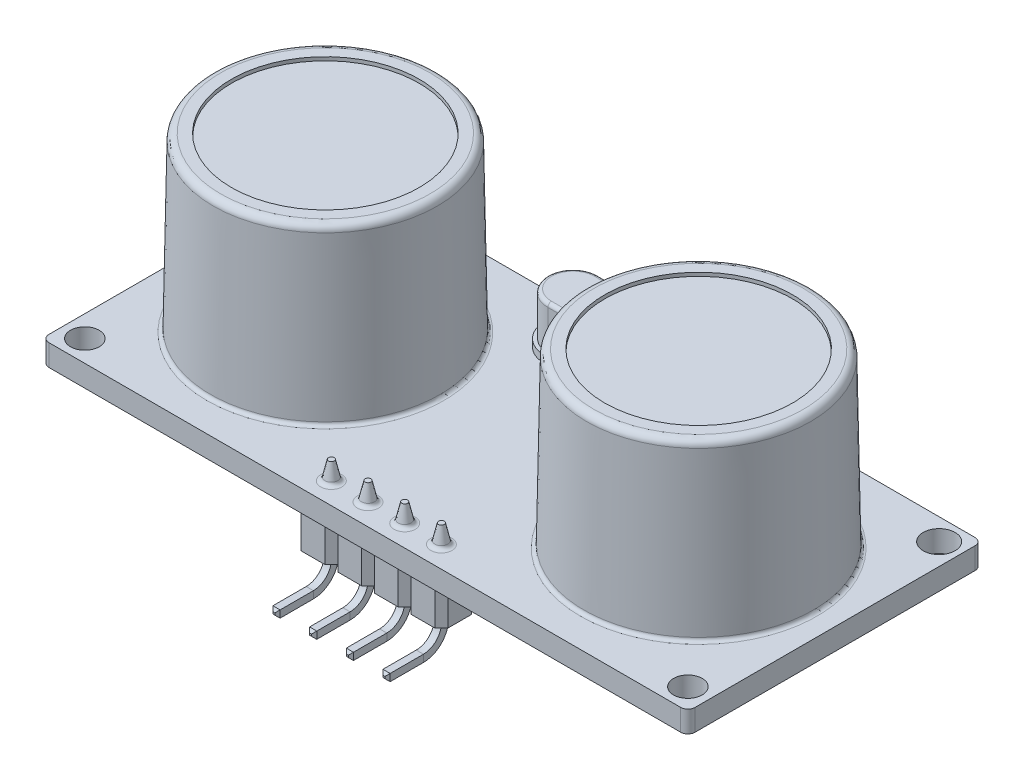
from build123d import *

# Parameters (mm, degrees)
SKETCH1_W                     = 45
SKETCH1_H                     = 20.5
BOSS_EXTRUDE1_DEPTH           = 1.5
SKETCH2_R                     = 1
SKETCH2_R_2                   = 1.109454148
CUT_EXTRUDE1_DEPTH            = 1.5
SKETCH3_R                     = 8
BOSS_EXTRUDE2_DEPTH           = 12
BOSS_EXTRUDE2_DRAFT           = 1
BOSS_EXTRUDE2_PROFILE_2_DEPTH = 12
BOSS_EXTRUDE2_PROFILE_2_DRAFT = 1
BOSS_EXTRUDE3_DEPTH           = 0.5
BOSS_EXTRUDE4_DEPTH           = 3
FILLET1_R                     = 0.25
SKETCH6_R                     = 6.540539221
CUT_EXTRUDE2_DEPTH            = 0.25
FILLET2_R                     = 0.25
FILLET3_R                     = 0.3
LPATTERN1_COUNT               = 4
LPATTERN1_PITCH               = 2.555
FILLET3_OF_LPATTERN1_R        = 0.3
BOSS_EXTRUDE5_DEPTH           = 2.5
LPATTERN2_COUNT               = 4
LPATTERN2_PITCH               = 2.555
SKETCH10_W                    = 0.5
SKETCH10_H                    = 0.5
CHAMFER1_SIZE                 = 0.18
LPATTERN3_COUNT               = 4
LPATTERN3_PITCH               = 2.555
CHAMFER1_OF_LPATTERN3_SIZE    = 0.18
SKETCH12_W                    = 10
SKETCH12_H                    = 4
BOSS_EXTRUDE6_DEPTH           = 0.5
BOSS_EXTRUDE7_START           = -0.5
SKETCH13_W                    = 0.2
SKETCH13_H                    = 6
BOSS_EXTRUDE7_DEPTH           = 0.15
LPATTERN4_COUNT               = 7
LPATTERN4_PITCH               = 1.3
MIRROR1_START                 = -0.5
MIRROR1_COPY_1_SKETCH_W       = 0.2
MIRROR1_COPY_1_SKETCH_H       = 6
MIRROR1_COPY_1_DEPTH          = 0.15
MIRROR1_COPY_2_SKETCH_W       = 0.2
MIRROR1_COPY_2_SKETCH_H       = 6
MIRROR1_COPY_2_DEPTH          = 0.15
MIRROR1_COPY_3_SKETCH_W       = 0.2
MIRROR1_COPY_3_SKETCH_H       = 6
MIRROR1_COPY_3_DEPTH          = 0.15
MIRROR1_COPY_4_SKETCH_W       = 0.2
MIRROR1_COPY_4_SKETCH_H       = 6
MIRROR1_COPY_4_DEPTH          = 0.15
MIRROR1_COPY_5_SKETCH_W       = 0.2
MIRROR1_COPY_5_SKETCH_H       = 6
MIRROR1_COPY_5_DEPTH          = 0.15
MIRROR1_COPY_6_SKETCH_W       = 0.2
MIRROR1_COPY_6_SKETCH_H       = 6
MIRROR1_COPY_6_DEPTH          = 0.15
SKETCH15_W                    = 1
SKETCH15_H                    = 0.35
BOSS_EXTRUDE8_DEPTH           = 0.3
SKETCH_PATTERN1_START         = -7.777519555
SKETCH_PATTERN1_OUTLINE_W     = 1
SKETCH_PATTERN1_OUTLINE_H     = 0.3
SKETCH_PATTERN1_OUTLINE_W_2   = 1.97077238
SKETCH_PATTERN1_DEPTH         = 0.35
SKETCH_PATTERN1_START_2       = 5.998202781
SKETCH_PATTERN1_2_OUTLINE_W   = 1
SKETCH_PATTERN1_2_OUTLINE_H   = 0.3
SKETCH_PATTERN1_2_DEPTH       = 0.35
SKETCH_PATTERN1_START_3       = 7.246338698
SKETCH_PATTERN1_3_OUTLINE_W   = 1
SKETCH_PATTERN1_3_OUTLINE_H   = 0.3
SKETCH_PATTERN1_3_DEPTH       = 0.35
SKETCH_PATTERN1_START_4       = -5.281247723
SKETCH_PATTERN1_4_OUTLINE_W   = 1
SKETCH_PATTERN1_4_OUTLINE_H   = 0.3
SKETCH_PATTERN1_4_DEPTH       = 0.35
SKETCH_PATTERN1_START_5       = -4.634066136
SKETCH_PATTERN1_5_OUTLINE_W   = 1
SKETCH_PATTERN1_5_OUTLINE_H   = 0.3
SKETCH_PATTERN1_5_DEPTH       = 0.35
SKETCH_PATTERN1_START_6       = -6.436929127
SKETCH_PATTERN1_6_OUTLINE_W   = 1
SKETCH_PATTERN1_6_OUTLINE_H   = 0.3
SKETCH_PATTERN1_6_DEPTH       = 0.35
SKETCH_PATTERN1_START_7       = 2.484931313
SKETCH_PATTERN1_7_OUTLINE_W   = 1
SKETCH_PATTERN1_7_OUTLINE_H   = 0.3
SKETCH_PATTERN1_7_DEPTH       = 0.35
SKETCH_PATTERN1_START_8       = 3.36324918
SKETCH_PATTERN1_8_OUTLINE_W   = 1
SKETCH_PATTERN1_8_OUTLINE_H   = 0.3
SKETCH_PATTERN1_8_DEPTH       = 0.35
SKETCH_PATTERN1_START_9       = 5.397248451
SKETCH_PATTERN1_9_OUTLINE_W   = 1
SKETCH_PATTERN1_9_OUTLINE_H   = 0.3
SKETCH_PATTERN1_9_DEPTH       = 0.35
FILLET4_R                     = 0.5
FILLET5_R                     = 0.5


# Read off the part's stored shape, not the designer's step: Sketch-Pattern1
with BuildPart() as part:
    # Sketch1 → Boss-Extrude1 (new body)
    with BuildSketch(Plane(origin=(0, 0, 0), x_dir=(1, 0, 0), z_dir=(0, 1, 0))):
        Rectangle(SKETCH1_W, SKETCH1_H)
    extrude(amount=BOSS_EXTRUDE1_DEPTH)

    # Sketch2 → Cut-Extrude1 (cut)
    with BuildSketch(Plane(origin=(0, 1.5, 0), x_dir=(1, 0, 0), z_dir=(0, 1, 0))):
        with Locations(Location((-21, 8.75, 0), (0, 0, 270))):
            Circle(SKETCH2_R)
        with Locations(Location((21, 8.75, 0), (0, 0, 270))):
            Circle(SKETCH2_R_2)
        with Locations(Location((21, -8.75, 0), (0, 0, 270))):
            Circle(SKETCH2_R)
        with Locations(Location((-21, -8.75, 0), (0, 0, 270))):
            Circle(SKETCH2_R)
    extrude(amount=-CUT_EXTRUDE1_DEPTH, mode=Mode.SUBTRACT)


with BuildPart() as boss_extrude2_tool:
    # Sketch3 → Boss-Extrude2 (with draft: the straight prism first)
    with BuildSketch(Plane(origin=(0, 1.5, 0), x_dir=(1, 0, 0), z_dir=(0, 1, 0))):
        with Locations((-13, 0)):
            Circle(SKETCH3_R)
    extrude(amount=BOSS_EXTRUDE2_DEPTH)
    # Boss-Extrude2: the draft: its side faces are tilted about the plane it starts from
    boss_extrude2_sides = [boss_extrude2_tool.faces().sort_by_distance(p)[0] for p in [
        (-21, 7.5, 0),
    ]]
    draft(boss_extrude2_sides, Plane(origin=(0, 1.5, 0), x_dir=(1, 0, 0), z_dir=(0, 1, 0)), BOSS_EXTRUDE2_DRAFT)


with BuildPart() as part_1:
    add(part.part)

    # Boss-Extrude2: add boss_extrude2_tool
    add(boss_extrude2_tool.part)


with BuildPart() as boss_extrude2_profile_2_tool:
    # Sketch3 → Boss-Extrude2 profile 2 (with draft: the straight prism first)
    with BuildSketch(Plane(origin=(0, 1.5, 0), x_dir=(1, 0, 0), z_dir=(0, 1, 0))):
        with Locations((13, 0)):
            Circle(SKETCH3_R)
    extrude(amount=BOSS_EXTRUDE2_PROFILE_2_DEPTH)
    # Boss-Extrude2 profile 2: the draft: its side faces are tilted about the plane it starts from
    boss_extrude2_profile_2_sides = [boss_extrude2_profile_2_tool.faces().sort_by_distance(p)[0] for p in [
        (5, 7.5, 0),
    ]]
    draft(boss_extrude2_profile_2_sides, Plane(origin=(0, 1.5, 0), x_dir=(1, 0, 0), z_dir=(0, 1, 0)), BOSS_EXTRUDE2_PROFILE_2_DRAFT)


with BuildPart() as part_2:
    add(part_1.part)

    # Boss-Extrude2 profile 2: add boss_extrude2_profile_2_tool
    add(boss_extrude2_profile_2_tool.part)

    # Sketch4 → Boss-Extrude3 (add)
    with BuildSketch(Plane(origin=(0, 1.5, 0), x_dir=(1, 0, 0), z_dir=(0, 1, 0))):
        with BuildLine():
            ThreePointArc((-5.5, 7.75), (-4.914213562, 6.335786438), (-3.5, 5.75))
            Line((-3.5, 5.75), (3.5, 5.75))
            ThreePointArc((3.5, 5.75), (4.914213562, 6.335786438), (5.5, 7.75))
            ThreePointArc((5.5, 7.75), (4.914213562, 9.164213562), (3.5, 9.75))
            Line((3.5, 9.75), (-3.5, 9.75))
            ThreePointArc((-3.5, 9.75), (-4.914213562, 9.164213562), (-5.5, 7.75))
        make_face()
    extrude(amount=BOSS_EXTRUDE3_DEPTH)

    # Sketch5 → Boss-Extrude4 (add)
    with BuildSketch(Plane(origin=(0, 2, 0), x_dir=(1, 0, 0), z_dir=(0, 1, 0))):
        with BuildLine():
            Line((3.5, 9.5), (-3.5, 9.5))
            ThreePointArc((-3.5, 9.5), (-5.25, 7.75), (-3.5, 6))
            Line((-3.5, 6), (3.5, 6))
            ThreePointArc((3.5, 6), (5.25, 7.75), (3.5, 9.5))
        make_face()
    extrude(amount=BOSS_EXTRUDE4_DEPTH)

    # Fillet1
    fillet1_edges = [part_2.edges().sort_by_distance(p)[0] for p in [
        (5.25, 5, -7.75),
        (0, 5, -9.5),
        (-5.25, 5, -7.75),
        (0, 5, -6),
    ]]
    fillet(fillet1_edges, radius=FILLET1_R)

    # Sketch6 → Cut-Extrude2 (cut)
    with BuildSketch(Plane(origin=(0, 13.5, 0), x_dir=(1, 0, 0), z_dir=(0, 1, 0))):
        with Locations(Location((-13, 0, 0), (0, 0, 270))):
            Circle(SKETCH6_R)
        with Locations(Location((13, 0, 0), (0, 0, 270))):
            Circle(SKETCH6_R)
    extrude(amount=-CUT_EXTRUDE2_DEPTH, mode=Mode.SUBTRACT)

    # Fillet2
    fillet2_edges = [part_2.edges().sort_by_distance(p)[0] for p in [
        (-21, 1.5, 0),
        (5, 1.5, 0),
    ]]
    fillet(fillet2_edges, radius=FILLET2_R)

    # Sketch8 → Revolve1 (revolve)
    with BuildSketch(Plane.XY.offset(8.75), mode=Mode.PRIVATE) as revolve1_sk:
        Polygon((3.8325, 1.5), (3.8325, 2.8), (4.0325, 2.8), (4.3325, 1.5), align=None)
    revolve1 = revolve(revolve1_sk.sketch.rotate(Axis((3.8325, 1.5, 8.75), (0, 1, 0)), 90), axis=Axis((3.8325, 1.5, 8.75), (0, 1, 0)))

    # Fillet3
    fillet3_edges = [part_2.edges().sort_by_distance(p)[0] for p in [
        (3.8325, 1.5, 9.25),
    ]]
    fillet(fillet3_edges, radius=FILLET3_R)

    # LPattern1: Revolve1 ×4
    with Locations(*[(-i * LPATTERN1_PITCH, 0, 0) for i in range(1, LPATTERN1_COUNT)]):
        add(revolve1)

    # Fillet3 of LPattern1
    fillet3_of_lpattern1_edges = [part_2.edges().sort_by_distance(p)[0] for p in [
        (1.2775, 1.5, 9.25),
        (-1.2775, 1.5, 9.25),
        (-3.8325, 1.5, 9.25),
    ]]
    fillet(fillet3_of_lpattern1_edges, radius=FILLET3_OF_LPATTERN1_R)

    # Sketch9 → Boss-Extrude5 (add)
    with BuildSketch(Plane.XZ):
        Polygon((3.005, 7.4725), (4.66, 7.4725), (5.11, 7.9225), (5.11, 9.5775), (4.66, 10.0275), (3.005, 10.0275), (2.555, 9.5775), (2.555, 7.9225), align=None)
    boss_extrude5 = extrude(amount=BOSS_EXTRUDE5_DEPTH)

    # LPattern2: Boss-Extrude5 ×4
    with Locations(*[(-i * LPATTERN2_PITCH, 0, 0) for i in range(1, LPATTERN2_COUNT)]):
        add(boss_extrude5)

    # Sweep1: sweep along a path in Sketch11
    with BuildLine(Plane(origin=(3.8325, 0, 0), x_dir=(0, 0, -1), z_dir=(1, 0, 0))) as sweep1_path:
        Line((-8.75, -2.5), (-8.75, -3))
        ThreePointArc((-8.75, -3), (-9.189339828, -4.060660172), (-10.25, -4.5))
        Line((-10.25, -4.5), (-12.75, -4.5))
    # Sketch10 → Sweep1 (sweep)
    with BuildSketch(Plane.XZ.offset(2.5)):
        with Locations((3.8325, 8.75)):
            Rectangle(SKETCH10_W, SKETCH10_H)
    sweep1 = sweep(path=sweep1_path.line)

    # Chamfer1
    chamfer1_edges = [part_2.edges().sort_by_distance(p)[0] for p in [
        (4.0825, -4.5, 12.75),
        (3.8325, -4.25, 12.75),
        (3.5825, -4.5, 12.75),
        (3.8325, -4.75, 12.75),
    ]]
    chamfer(chamfer1_edges, length=CHAMFER1_SIZE)

    # LPattern3: Sweep1 ×4
    with Locations(*[(-i * LPATTERN3_PITCH, 0, 0) for i in range(1, LPATTERN3_COUNT)]):
        add(sweep1)

    # Chamfer1 of LPattern3
    chamfer1_of_lpattern3_edges = [part_2.edges().sort_by_distance(p)[0] for p in [
        (1.5275, -4.5, 12.75),
        (1.2775, -4.25, 12.75),
        (1.0275, -4.5, 12.75),
        (1.2775, -4.75, 12.75),
        (-1.0275, -4.5, 12.75),
        (-1.2775, -4.25, 12.75),
        (-1.5275, -4.5, 12.75),
        (-1.2775, -4.75, 12.75),
        (-3.5825, -4.5, 12.75),
        (-3.8325, -4.25, 12.75),
        (-4.0825, -4.5, 12.75),
        (-3.8325, -4.75, 12.75),
    ]]
    chamfer(chamfer1_of_lpattern3_edges, length=CHAMFER1_OF_LPATTERN3_SIZE)

    # Sketch12 → Boss-Extrude6 (add)
    with BuildSketch(Plane.XZ):
        with Locations((12.5, 0)):
            Rectangle(SKETCH12_W, SKETCH12_H)
    boss_extrude6 = extrude(amount=BOSS_EXTRUDE6_DEPTH)

    # Sketch13 → Boss-Extrude7 (add)
    with BuildSketch(Plane.XZ.offset(0.5).offset(BOSS_EXTRUDE7_START)):
        with Locations((16.5, 0)):
            Rectangle(SKETCH13_W, SKETCH13_H)
    boss_extrude7 = extrude(amount=BOSS_EXTRUDE7_DEPTH)

    # LPattern4: Boss-Extrude7 ×7
    with Locations(*[(-i * LPATTERN4_PITCH, 0, 0) for i in range(1, LPATTERN4_COUNT)]):
        add(boss_extrude7)

    # Mirror1: Boss-Extrude6, Boss-Extrude7 across plane
    add(boss_extrude6.mirror(Plane(origin=(0, 0, 0), x_dir=(0, 0, 1), z_dir=(1, 0, 0))))
    add(boss_extrude7.mirror(Plane(origin=(0, 0, 0), x_dir=(0, 0, 1), z_dir=(1, 0, 0))))

    # Mirror1 copy 1 sketch → Mirror1 copy 1 (add)
    with BuildSketch(Plane(origin=(1.3, -0.5, 0), x_dir=(-1, 0, 0), z_dir=(0, -1, 0)).offset(MIRROR1_START)):
        with Locations((16.5, 0)):
            Rectangle(MIRROR1_COPY_1_SKETCH_W, MIRROR1_COPY_1_SKETCH_H)
    extrude(amount=MIRROR1_COPY_1_DEPTH)

    # Mirror1 copy 2 sketch → Mirror1 copy 2 (add)
    with BuildSketch(Plane(origin=(2.6, -0.5, 0), x_dir=(-1, 0, 0), z_dir=(0, -1, 0)).offset(MIRROR1_START)):
        with Locations((16.5, 0)):
            Rectangle(MIRROR1_COPY_2_SKETCH_W, MIRROR1_COPY_2_SKETCH_H)
    extrude(amount=MIRROR1_COPY_2_DEPTH)

    # Mirror1 copy 3 sketch → Mirror1 copy 3 (add)
    with BuildSketch(Plane(origin=(3.9, -0.5, 0), x_dir=(-1, 0, 0), z_dir=(0, -1, 0)).offset(MIRROR1_START)):
        with Locations((16.5, 0)):
            Rectangle(MIRROR1_COPY_3_SKETCH_W, MIRROR1_COPY_3_SKETCH_H)
    extrude(amount=MIRROR1_COPY_3_DEPTH)

    # Mirror1 copy 4 sketch → Mirror1 copy 4 (add)
    with BuildSketch(Plane(origin=(5.2, -0.5, 0), x_dir=(-1, 0, 0), z_dir=(0, -1, 0)).offset(MIRROR1_START)):
        with Locations((16.5, 0)):
            Rectangle(MIRROR1_COPY_4_SKETCH_W, MIRROR1_COPY_4_SKETCH_H)
    extrude(amount=MIRROR1_COPY_4_DEPTH)

    # Mirror1 copy 5 sketch → Mirror1 copy 5 (add)
    with BuildSketch(Plane(origin=(6.5, -0.5, 0), x_dir=(-1, 0, 0), z_dir=(0, -1, 0)).offset(MIRROR1_START)):
        with Locations((16.5, 0)):
            Rectangle(MIRROR1_COPY_5_SKETCH_W, MIRROR1_COPY_5_SKETCH_H)
    extrude(amount=MIRROR1_COPY_5_DEPTH)

    # Mirror1 copy 6 sketch → Mirror1 copy 6 (add)
    with BuildSketch(Plane(origin=(7.8, -0.5, 0), x_dir=(-1, 0, 0), z_dir=(0, -1, 0)).offset(MIRROR1_START)):
        with Locations((16.5, 0)):
            Rectangle(MIRROR1_COPY_6_SKETCH_W, MIRROR1_COPY_6_SKETCH_H)
    extrude(amount=MIRROR1_COPY_6_DEPTH)

    # Sketch15 → Boss-Extrude8 (add)
    with BuildSketch(Plane.XZ):
        with Locations((-16.595584963, 7.421338698)):
            Rectangle(SKETCH15_W, SKETCH15_H)
    extrude(amount=BOSS_EXTRUDE8_DEPTH)

    # Sketch-Pattern1 outline → Sketch-Pattern1 (add)
    with BuildSketch(Plane.XY.offset(SKETCH_PATTERN1_START)):
        with Locations((15.453414895, -0.15)):
            Rectangle(SKETCH_PATTERN1_OUTLINE_W, SKETCH_PATTERN1_OUTLINE_H)
        with Locations((13.822257126, -0.15)):
            Rectangle(SKETCH_PATTERN1_OUTLINE_W, SKETCH_PATTERN1_OUTLINE_H)
        with Locations((11.92663209, -0.15)):
            Rectangle(SKETCH_PATTERN1_OUTLINE_W, SKETCH_PATTERN1_OUTLINE_H)
        with Locations((-10.031314588, -0.15)):
            Rectangle(SKETCH_PATTERN1_OUTLINE_W, SKETCH_PATTERN1_OUTLINE_H)
        with Locations((-11.857291206, -0.15)):
            Rectangle(SKETCH_PATTERN1_OUTLINE_W_2, SKETCH_PATTERN1_OUTLINE_H)
    extrude(amount=SKETCH_PATTERN1_DEPTH)

    # Sketch-Pattern1 2 outline → Sketch-Pattern1 2 (add)
    with BuildSketch(Plane.XY.offset(SKETCH_PATTERN1_START_2)):
        with Locations((10.442589779, -0.15)):
            Rectangle(SKETCH_PATTERN1_2_OUTLINE_W, SKETCH_PATTERN1_2_OUTLINE_H)
        with Locations((8.92186044, -0.15)):
            Rectangle(SKETCH_PATTERN1_2_OUTLINE_W, SKETCH_PATTERN1_2_OUTLINE_H)
        with Locations((12.342677396, -0.15)):
            Rectangle(SKETCH_PATTERN1_2_OUTLINE_W, SKETCH_PATTERN1_2_OUTLINE_H)
        with Locations((14.03931734, -0.15)):
            Rectangle(SKETCH_PATTERN1_2_OUTLINE_W, SKETCH_PATTERN1_2_OUTLINE_H)
        with Locations((15.866934666, -0.15)):
            Rectangle(SKETCH_PATTERN1_2_OUTLINE_W, SKETCH_PATTERN1_2_OUTLINE_H)
    extrude(amount=SKETCH_PATTERN1_2_DEPTH)

    # Sketch-Pattern1 3 outline → Sketch-Pattern1 3 (add)
    with BuildSketch(Plane.XY.offset(SKETCH_PATTERN1_START_3)):
        with Locations((-8.135997085, -0.15)):
            Rectangle(SKETCH_PATTERN1_3_OUTLINE_W, SKETCH_PATTERN1_3_OUTLINE_H)
        with Locations((-13.821949593, -0.15)):
            Rectangle(SKETCH_PATTERN1_3_OUTLINE_W, SKETCH_PATTERN1_3_OUTLINE_H)
        with Locations((-15.30122179, -0.15)):
            Rectangle(SKETCH_PATTERN1_3_OUTLINE_W, SKETCH_PATTERN1_3_OUTLINE_H)
        with Locations((-11.834177578, -0.15)):
            Rectangle(SKETCH_PATTERN1_3_OUTLINE_W, SKETCH_PATTERN1_3_OUTLINE_H)
    extrude(amount=SKETCH_PATTERN1_3_DEPTH)

    # Sketch-Pattern1 4 outline → Sketch-Pattern1 4 (add)
    with BuildSketch(Plane.XY.offset(SKETCH_PATTERN1_START_4)):
        with Locations((-16.595584963, -0.15)):
            Rectangle(SKETCH_PATTERN1_4_OUTLINE_W, SKETCH_PATTERN1_4_OUTLINE_H)
        with Locations((-14.977630997, -0.15)):
            Rectangle(SKETCH_PATTERN1_4_OUTLINE_W, SKETCH_PATTERN1_4_OUTLINE_H)
    extrude(amount=SKETCH_PATTERN1_4_DEPTH)

    # Sketch-Pattern1 5 outline → Sketch-Pattern1 5 (add)
    with BuildSketch(Plane.XY.offset(SKETCH_PATTERN1_START_5)):
        with Locations((2.733773449, -0.15)):
            Rectangle(SKETCH_PATTERN1_5_OUTLINE_W, SKETCH_PATTERN1_5_OUTLINE_H)
        with Locations((1.109454148, -0.15)):
            Rectangle(SKETCH_PATTERN1_5_OUTLINE_W, SKETCH_PATTERN1_5_OUTLINE_H)
    extrude(amount=SKETCH_PATTERN1_5_DEPTH)

    # Sketch-Pattern1 6 outline → Sketch-Pattern1 6 (add)
    with BuildSketch(Plane.XY.offset(SKETCH_PATTERN1_START_6)):
        with Locations((-8.135997085, -0.15)):
            Rectangle(SKETCH_PATTERN1_6_OUTLINE_W, SKETCH_PATTERN1_6_OUTLINE_H)
    extrude(amount=SKETCH_PATTERN1_6_DEPTH)

    # Sketch-Pattern1 7 outline → Sketch-Pattern1 7 (add)
    with BuildSketch(Plane.XY.offset(SKETCH_PATTERN1_START_7)):
        with Locations((3.883089518, -0.15)):
            Rectangle(SKETCH_PATTERN1_7_OUTLINE_W, SKETCH_PATTERN1_7_OUTLINE_H)
    extrude(amount=SKETCH_PATTERN1_7_DEPTH)

    # Sketch-Pattern1 8 outline → Sketch-Pattern1 8 (add)
    with BuildSketch(Plane.XY.offset(SKETCH_PATTERN1_START_8)):
        with Locations((4.807634641, -0.15)):
            Rectangle(SKETCH_PATTERN1_8_OUTLINE_W, SKETCH_PATTERN1_8_OUTLINE_H)
    extrude(amount=SKETCH_PATTERN1_8_DEPTH)

    # Sketch-Pattern1 9 outline → Sketch-Pattern1 9 (add)
    with BuildSketch(Plane.XY.offset(SKETCH_PATTERN1_START_9)):
        with Locations((-8.135997085, -0.15)):
            Rectangle(SKETCH_PATTERN1_9_OUTLINE_W, SKETCH_PATTERN1_9_OUTLINE_H)
    extrude(amount=SKETCH_PATTERN1_9_DEPTH)

    # Fillet4
    fillet4_edges = [part_2.edges().sort_by_distance(p)[0] for p in [
        (-20.790539221, 13.5, 0),
        (5.209460779, 13.5, 0),
    ]]
    fillet(fillet4_edges, radius=FILLET4_R)

    # Fillet5
    fillet5_edges = [part_2.edges().sort_by_distance(p)[0] for p in [
        (22.5, 0.75, 10.25),
        (-22.5, 0.75, 10.25),
        (-22.5, 0.75, -10.25),
        (22.5, 0.75, -10.25),
    ]]
    fillet(fillet5_edges, radius=FILLET5_R)


solid = part_2.part
